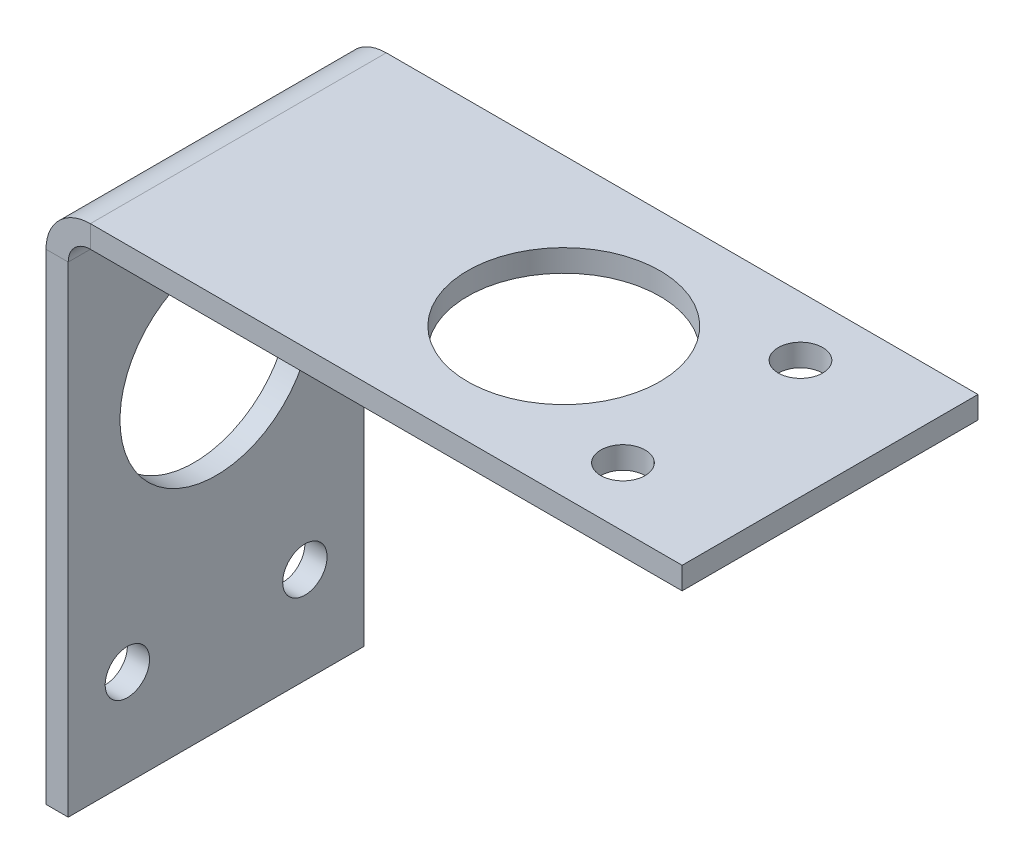
from build123d import *

# Parameters (mm, degrees)
BASE_FLANGE1_DEPTH = 40
SKETCH2_R          = 13
CUT_EXTRUDE1_DEPTH = 115.512008104
SKETCH3_R          = 13
CUT_EXTRUDE2_DEPTH = 117.704755687
SKETCH4_R          = 3
CUT_EXTRUDE3_DEPTH = 10
SKETCH5_R          = 3
CUT_EXTRUDE4_DEPTH = 10


# Sheet-metal steps are written as plain solids
with BuildPart() as part:
    # Sketch1 → Base-Flange1 (new body)
    with BuildSketch(Plane.XY):
        with BuildLine():
            Line((0, 0), (-80, 0))
            ThreePointArc((-80, 0), (-82.121320344, -0.878679656), (-83, -3))
            Line((-83, -3), (-83, -68))
            Line((-83, -68), (-86, -68))
            Line((-86, -68), (-86, -3))
            ThreePointArc((-86, -3), (-84.242640687, 1.242640687), (-80, 3))
            Line((-80, 3), (0, 3))
            Line((0, 3), (0, 0))
        make_face()
    extrude(amount=BASE_FLANGE1_DEPTH)

    # Sketch2 → Cut-Extrude1 (cut, through all)
    with BuildSketch(Plane(origin=(-83, 0, 0), x_dir=(0, 0, -1), z_dir=(1, 0, 0))):
        with Locations(Location((-20, -25, 0), (0, 0, 90))):
            Circle(SKETCH2_R)
    extrude(amount=-CUT_EXTRUDE1_DEPTH, mode=Mode.SUBTRACT)

    # Sketch3 → Cut-Extrude2 (cut, through all)
    with BuildSketch(Plane.XZ):
        with Locations((-36, 20)):
            Circle(SKETCH3_R)
    extrude(amount=-CUT_EXTRUDE2_DEPTH, mode=Mode.SUBTRACT)

    # Sketch4 → Cut-Extrude3 (cut)
    with BuildSketch(Plane(origin=(0, 0, 0), x_dir=(-1, 0, 0), z_dir=(0, -1, 0))):
        with Locations(Location((16, -32, 0), (0, 0, 180))):
            Circle(SKETCH4_R)
        with Locations(Location((16, -8, 0), (0, 0, 180))):
            Circle(SKETCH4_R)
    extrude(amount=-CUT_EXTRUDE3_DEPTH, mode=Mode.SUBTRACT)

    # Sketch5 → Cut-Extrude4 (cut)
    with BuildSketch(Plane(origin=(-83, 0, 0), x_dir=(0, 0, -1), z_dir=(1, 0, 0))):
        with Locations(Location((-32, -55, 0), (0, 0, 90))):
            Circle(SKETCH5_R)
        with Locations(Location((-8, -55, 0), (0, 0, 90))):
            Circle(SKETCH5_R)
    extrude(amount=-CUT_EXTRUDE4_DEPTH, mode=Mode.SUBTRACT)


solid = part.part
